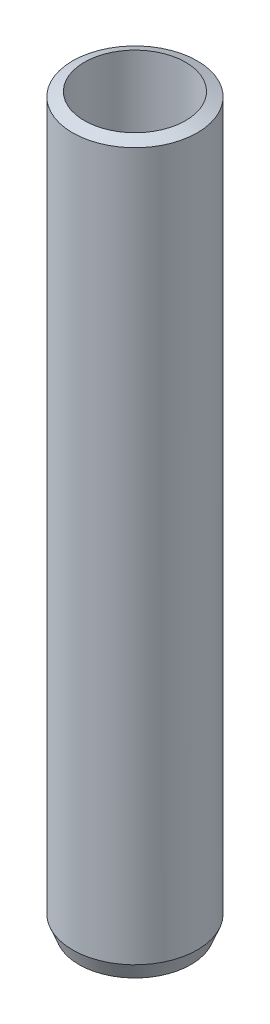
from build123d import *

# Parameters (mm, degrees)
SKETCH1_R           = 32.5
BOSS_EXTRUDE1_DEPTH = 380.445133
SKETCH2_R           = 26.387532092
CUT_EXTRUDE1_DEPTH  = 384.211428879
CHAMFER1_SIZE       = 3.305936
CHAMFER1_SIZE_2     = 8.298804


with BuildPart() as part:
    # Sketch1 → Boss-Extrude1 (new body)
    with BuildSketch(Plane(origin=(0, 0, 0), x_dir=(1, 0, 0), z_dir=(0, 1, 0))):
        with Locations(Location((0, 0, 0), (0, 0, 270))):
            Circle(SKETCH1_R)
    extrude(amount=BOSS_EXTRUDE1_DEPTH)

    # Sketch2 → Cut-Extrude1 (cut, through all)
    with BuildSketch(Plane(origin=(0, 0, 0), x_dir=(1, 0, 0), z_dir=(0, 1, 0))):
        with Locations(Location((0, 0, 0), (0, 0, 270))):
            Circle(SKETCH2_R)
    extrude(amount=CUT_EXTRUDE1_DEPTH, mode=Mode.SUBTRACT)

    # Chamfer1
    # the kernel refuses this chamfer: 8.298804, 3.305936 mm, written as the material it takes off along each edge
    with BuildSketch(Plane(origin=(0, 380.445133, 0), x_dir=(0, 0, 1), z_dir=(-1, 0, 0))) as chamfer1_piece_1:
        Polygon((32.5, -CHAMFER1_SIZE), (32.5 - CHAMFER1_SIZE_2, 0), (32.5, 0), align=None)
    revolve(axis=Axis((0, 380.445133, 0), (0, 1, 0)), mode=Mode.SUBTRACT)
    with BuildSketch(Plane(origin=(0, 0, 0), x_dir=(0, 0, 1), z_dir=(-1, 0, 0))) as chamfer1_piece_2:
        Polygon((32.5, CHAMFER1_SIZE_2), (32.5 - CHAMFER1_SIZE, 0), (32.5, 0), align=None)
    revolve(axis=Axis((0, 0, 0), (0, 1, 0)), mode=Mode.SUBTRACT)


solid = part.part
